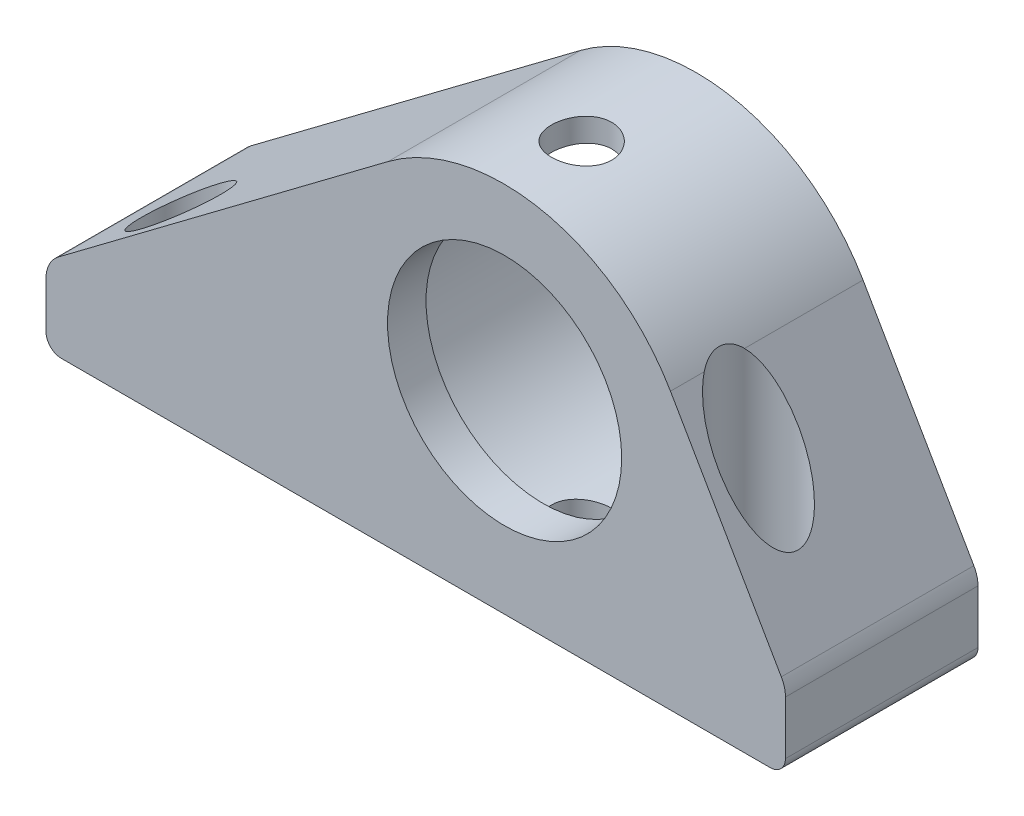
from build123d import *

# Parameters (mm, degrees)
SALIENTE_EXTRUIR1_DEPTH = 15.875
REDONDEO1_R             = 15.875
CORTAR_EXTRUIR1_REACH   = 48.084
CROQUIS2_R              = 9.652
CORTAR_EXTRUIR2_START   = -3.175
CROQUIS3_R              = 12.827
CORTAR_EXTRUIR2_DEPTH   = 43.909243503
CROQUIS4_R              = 3.2639
CROQUIS4_R_2            = 2.4892
CORTAR_EXTRUIR3_DEPTH   = 47.084243503
REDONDEO2_R             = 1.27
REDONDEO3_R             = 2.54


with BuildPart() as part:
    # Croquis1 → Saliente-Extruir1 (new body)
    with BuildSketch(Plane.XY):
        Polygon((30.48, 0), (-30.48, 0), (-30.48, 6.35), (12.046472996, 38.277805334), (30.48, 6.35), align=None)
    extrude(amount=SALIENTE_EXTRUIR1_DEPTH)

    # Redondeo1
    redondeo1_edges = [part.edges().sort_by_distance(p)[0] for p in [
        (12.046472996, 38.277805334, 7.9375),
    ]]
    fillet(redondeo1_edges, radius=REDONDEO1_R)

    # Croquis2 → Cortar-Extruir1 (cut, up to next)
    with BuildSketch(Plane.XY.offset(15.875), mode=Mode.PRIVATE) as cortar_extruir1_sk1:
        with Locations((7.327326484, 15.97160686)):
            Circle(CROQUIS2_R)
    cortar_extruir1_tool1 = extrude(cortar_extruir1_sk1.sketch, amount=-CORTAR_EXTRUIR1_REACH, mode=Mode.PRIVATE) & part.part
    add(cortar_extruir1_tool1.solids().sort_by_distance((7.327326, 15.971607, 15.875))[0], mode=Mode.SUBTRACT)

    # Croquis3 → Cortar-Extruir2 (cut, through all)
    with BuildSketch(Plane.XY.offset(15.875).offset(CORTAR_EXTRUIR2_START)):
        with Locations((7.327326484, 15.97160686)):
            Circle(CROQUIS3_R)
    extrude(amount=-CORTAR_EXTRUIR2_DEPTH, mode=Mode.SUBTRACT)

    # Croquis4 → Cortar-Extruir3 (cut, through all)
    with BuildSketch(Plane.XZ):
        with Locations((-23.8125, 11.43)):
            Circle(CROQUIS4_R)
        with Locations((23.8125, 11.43)):
            Circle(CROQUIS4_R)
        with Locations((7.327326484, 9.525)):
            Circle(CROQUIS4_R_2)
    extrude(amount=-CORTAR_EXTRUIR3_DEPTH, mode=Mode.SUBTRACT)

    # Redondeo2
    redondeo2_edges = [part.edges().sort_by_distance(p)[0] for p in [
        (30.48, 0, 7.9375),
        (-30.48, 0, 7.9375),
    ]]
    fillet(redondeo2_edges, radius=REDONDEO2_R)

    # Redondeo3
    redondeo3_edges = [part.edges().sort_by_distance(p)[0] for p in [
        (30.48, 6.35, 7.9375),
        (-30.48, 6.35, 7.9375),
    ]]
    fillet(redondeo3_edges, radius=REDONDEO3_R)


solid = part.part
